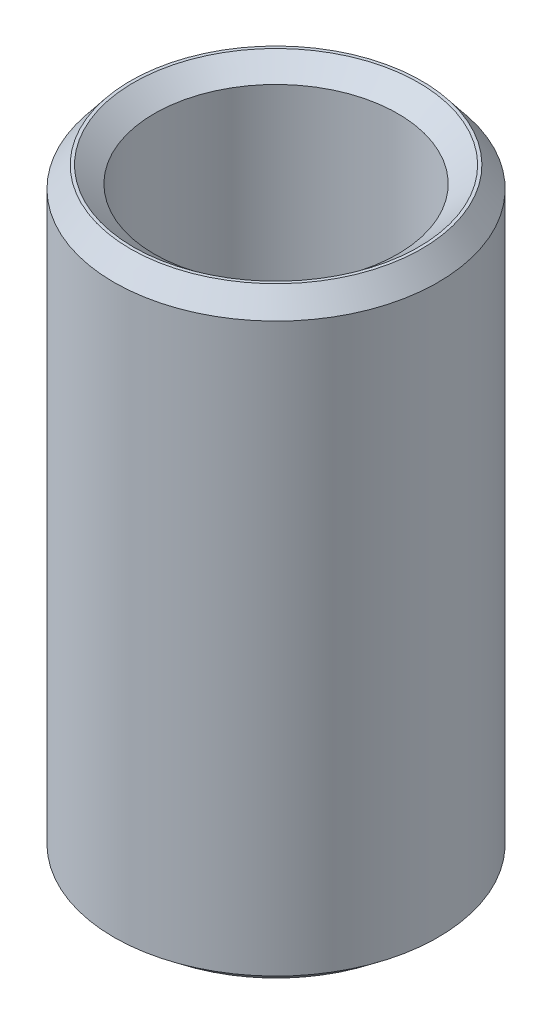
from build123d import *
from OCP.BRepFilletAPI import BRepFilletAPI_MakeChamfer

# Parameters (mm, degrees)
SKETCH1_R           = 25
BOSS_EXTRUDE1_DEPTH = 93.274617432
SKETCH2_R           = 18.787946378
CUT_EXTRUDE1_DEPTH  = 100.750459934
CHAMFER1_SIZE       = 3.208150459
CHAMFER1_SIZE2      = 2.535756792


with BuildPart() as part:
    # Sketch1 → Boss-Extrude1 (new body)
    with BuildSketch(Plane(origin=(0, 0, 0), x_dir=(1, 0, 0), z_dir=(0, 1, 0))):
        Circle(SKETCH1_R)
    extrude(amount=BOSS_EXTRUDE1_DEPTH)

    # Sketch2 → Cut-Extrude1 (cut, through all)
    with BuildSketch(Plane(origin=(0, 0, 0), x_dir=(1, 0, 0), z_dir=(0, 1, 0))):
        Circle(SKETCH2_R)
    extrude(amount=CUT_EXTRUDE1_DEPTH, mode=Mode.SUBTRACT)

    # Chamfer1: one chamfer whose edges measure the first distance from different faces: ONE call of the kernel's chamfer builder (chamfer() names one face for all edges)
    chamfer1_edges_1 = [part.edges().sort_by_distance(p)[0] for p in [
        (-18.787946378, 93.274617432, 0),
    ]]
    chamfer1_side_1 = [part.faces().sort_by_distance(p)[0] for p in [
        (-24.292893219, 93.274617432, 0),
    ]]
    chamfer1_edges_2 = [part.edges().sort_by_distance(p)[0] for p in [
        (-18.787946378, 0, 0),
    ]]
    chamfer1_side_2 = [part.faces().sort_by_distance(p)[0] for p in [
        (-18.787946378, 46.637308716, 0),
    ]]
    chamfer1_edges_3 = [part.edges().sort_by_distance(p)[0] for p in [
        (-25, 0, 0),
    ]]
    chamfer1_side_3 = [part.faces().sort_by_distance(p)[0] for p in [
        (-24.292893219, 0, 0),
    ]]
    chamfer1_edges_4 = [part.edges().sort_by_distance(p)[0] for p in [
        (-25, 93.274617432, 0),
    ]]
    chamfer1_side_4 = [part.faces().sort_by_distance(p)[0] for p in [
        (-25, 46.637308716, 0),
    ]]
    chamfer1 = BRepFilletAPI_MakeChamfer(part.part.solid().wrapped)
    for e in chamfer1_edges_1:
        chamfer1.Add(CHAMFER1_SIZE, CHAMFER1_SIZE2, e.wrapped, chamfer1_side_1[0].wrapped)  # the first distance lies on this face
    for e in chamfer1_edges_2:
        chamfer1.Add(CHAMFER1_SIZE, CHAMFER1_SIZE2, e.wrapped, chamfer1_side_2[0].wrapped)  # the first distance lies on this face
    for e in chamfer1_edges_3:
        chamfer1.Add(CHAMFER1_SIZE, CHAMFER1_SIZE2, e.wrapped, chamfer1_side_3[0].wrapped)  # the first distance lies on this face
    for e in chamfer1_edges_4:
        chamfer1.Add(CHAMFER1_SIZE, CHAMFER1_SIZE2, e.wrapped, chamfer1_side_4[0].wrapped)  # the first distance lies on this face
    add(Compound.cast(chamfer1.Shape()), mode=Mode.REPLACE)


solid = part.part
